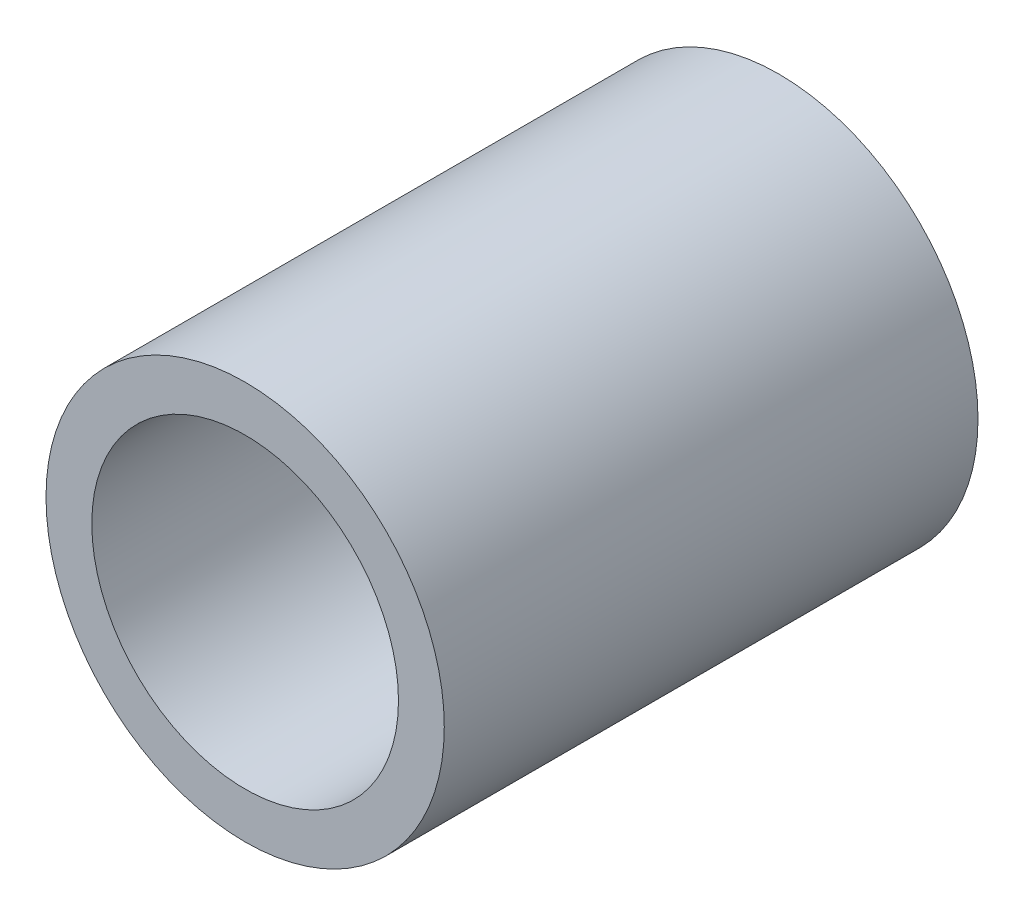
from build123d import *

# Parameters (mm, degrees)
SKETCH1_R           = 6.35
SKETCH1_R_2         = 4.8895
BOSS_EXTRUDE1_DEPTH = 17.018


with BuildPart() as part:
    # Sketch1 → Boss-Extrude1 (new body)
    with BuildSketch(Plane.XY):
        Circle(SKETCH1_R)
        Circle(SKETCH1_R_2, mode=Mode.SUBTRACT)
    extrude(amount=BOSS_EXTRUDE1_DEPTH)


solid = part.part
